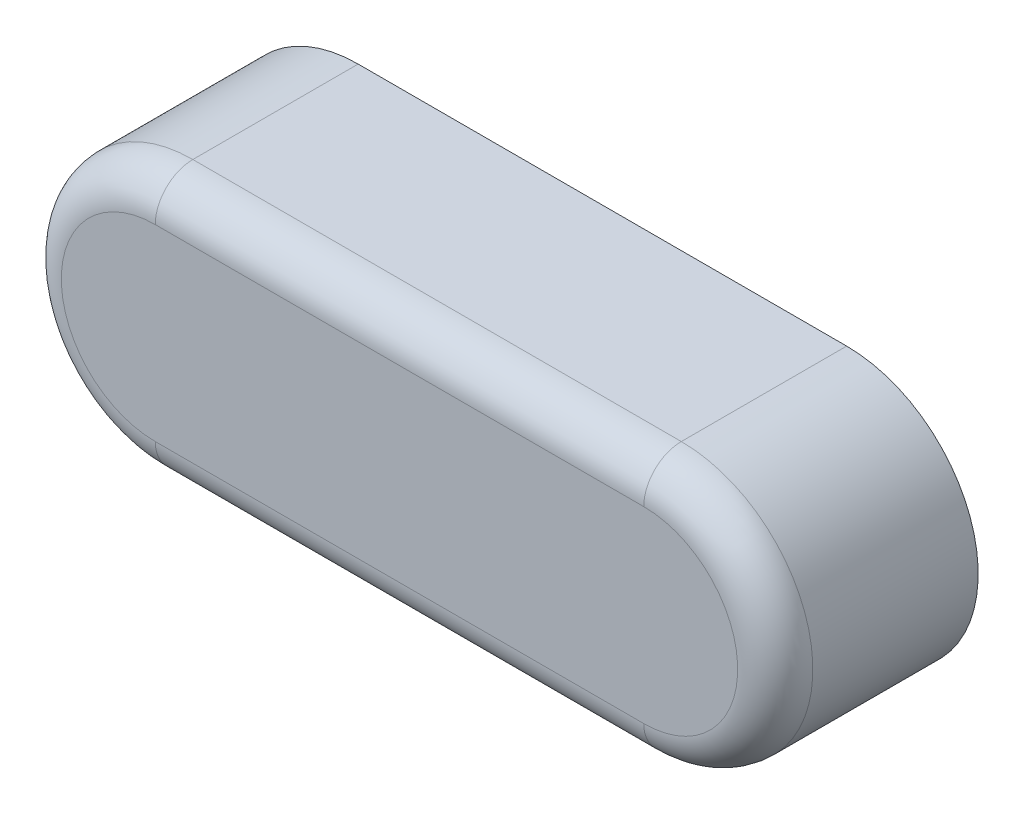
from build123d import *

# Parameters (mm, degrees)
BOSS_EXTRUDE1_DEPTH = 2.7
FILLET1_R           = 0.5


with BuildPart() as part:
    # Sketch1 → Boss-Extrude1 (new body)
    with BuildSketch(Plane.XY):
        with BuildLine():
            Line((-3.25, 1.75), (3.25, 1.75))
            ThreePointArc((3.25, 1.75), (5, 0), (3.25, -1.75))
            Line((3.25, -1.75), (-3.25, -1.75))
            ThreePointArc((-3.25, -1.75), (-5, 0), (-3.25, 1.75))
        make_face()
    extrude(amount=BOSS_EXTRUDE1_DEPTH)

    # Fillet1
    fillet1_edges = [part.edges().sort_by_distance(p)[0] for p in [
        (5, 0, 2.7),
        (0, -1.75, 2.7),
        (-5, 0, 2.7),
        (0, 1.75, 2.7),
    ]]
    fillet(fillet1_edges, radius=FILLET1_R)


solid = part.part
